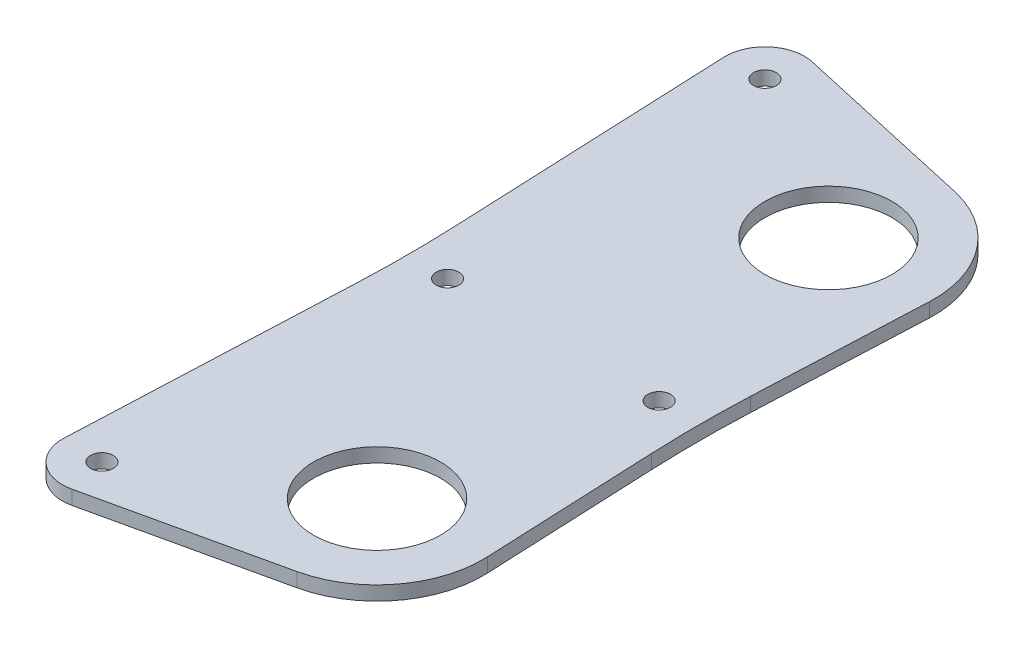
from build123d import *

# Parameters (mm, degrees)
SKETCH1_W                  = 88.9
SKETCH1_H                  = 177.8
SKETCH1_R                  = 14.2875
BOSS_EXTRUDE1_DEPTH        = 3.175
F_10_CLEARANCE_HOLE1_D     = 5.1054
F_10_CLEARANCE_HOLE1_DEPTH = 3.175
F_10_CLEARANCE_HOLE1_TIP   = 1.533816902
SKETCH4_OUTSIDE_W          = 130.662
SKETCH4_OUTSIDE_H          = 219.562
CUT_EXTRUDE1_DEPTH         = 103.439887861


with BuildPart() as part:
    # Sketch1 → Boss-Extrude1 (new body)
    with BuildSketch(Plane(origin=(0, 0, 0), x_dir=(1, 0, 0), z_dir=(0, 1, 0))):
        with Locations((-6.35, 0)):
            Rectangle(SKETCH1_W, SKETCH1_H)
        with Locations((0, 50.8)):
            Circle(SKETCH1_R, mode=Mode.SUBTRACT)
        with Locations((0, -50.8)):
            Circle(SKETCH1_R, mode=Mode.SUBTRACT)
    extrude(amount=BOSS_EXTRUDE1_DEPTH)

    # #10 Clearance Hole1
    with Locations(Plane(origin=(0, 3.175, 0), x_dir=(1, 0, 0), z_dir=(0, 1, 0))):
        with Locations((12.7, 0), (-38.1, 74.6125), (-38.1, -74.6125), (-34.925, 0)):
            Hole(F_10_CLEARANCE_HOLE1_D / 2, depth=F_10_CLEARANCE_HOLE1_DEPTH)
            with Locations((0, 0, -(F_10_CLEARANCE_HOLE1_DEPTH + F_10_CLEARANCE_HOLE1_TIP / 2))):  # 118° drill point
                Cone(0, F_10_CLEARANCE_HOLE1_D / 2, F_10_CLEARANCE_HOLE1_TIP, mode=Mode.SUBTRACT)

    # Sketch4 outside → Cut-Extrude1 (cut, through all)
    with BuildSketch(Plane(origin=(0, 3.175, 0), x_dir=(1, 0, 0), z_dir=(0, 1, 0))):
        with Locations((-6.35, 0)):
            Rectangle(SKETCH4_OUTSIDE_W, SKETCH4_OUTSIDE_H)
        with BuildLine():
            Line((5.204384, 74.036814399), (-36.154254302, 83.299970343))
            ThreePointArc((-36.154254302, 83.299970343), (-43.811370677, 81.441724867), (-46.994650541, 74.234004232))
            Line((-46.994650541, 74.234004232), (-44.295277511, 10.798738023))
            ThreePointArc((-44.295277511, 10.798738023), (-44.065621044, 0), (-44.295277511, -10.798738023))
            Line((-44.295277511, -10.798738023), (-46.994650541, -74.234004232))
            ThreePointArc((-46.994650541, -74.234004232), (-43.811370677, -81.441724867), (-36.154254302, -83.299970343))
            Line((-36.154254302, -83.299970343), (5.204384, -74.036814399))
            ThreePointArc((5.204384, -74.036814399), (18.908305615, -65.274499474), (23.789710982, -49.758458995))
            Line((23.789710982, -49.758458995), (22.097626801, -11.109770716))
            ThreePointArc((22.097626801, -11.109770716), (21.854543937, 0), (22.097626801, 11.109770716))
            Line((22.097626801, 11.109770716), (23.789710982, 49.758458995))
            ThreePointArc((23.789710982, 49.758458995), (18.908305615, 65.274499474), (5.204384, 74.036814399))
        make_face(mode=Mode.SUBTRACT)
    extrude(amount=-CUT_EXTRUDE1_DEPTH, mode=Mode.SUBTRACT)


solid = part.part
